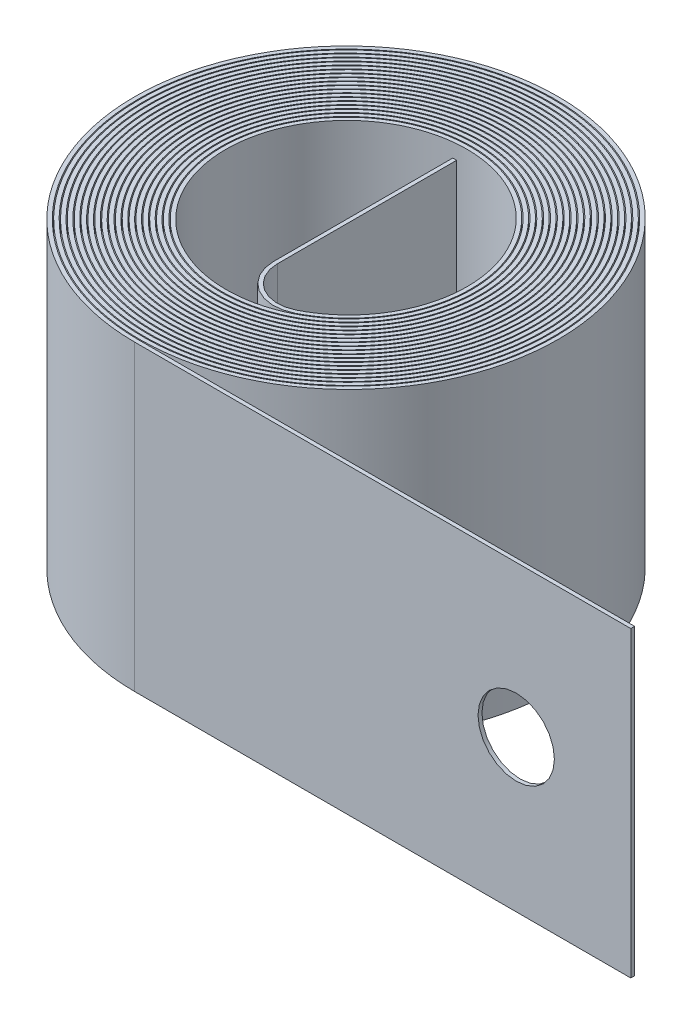
from build123d import *

# Parameters (mm, degrees)
EXTRUDE_THIN1_DEPTH = 7.9248
CUT_EXTRUDE2_REACH  = 20.849
SKETCH4_R           = 1


# Read off the part's stored shape, not the designer's step: Extrude-Thin1
with BuildPart() as part:
    # Extrude-Thin1 outline → Extrude-Thin1 (new body)
    with BuildSketch(Plane(origin=(0, 0, 0), x_dir=(1, 0, 0), z_dir=(0, 1, 0))):
        with BuildLine():
            Line((0.1016, -1.942264109), (0.1016, 2.75))
            Line((0.1016, 2.75), (0, 2.75))
            Line((0, 2.75), (0, -1.942264109))
            ThreePointArc((0, -1.942264109), (0.475427978, -2.793630184), (1.449648387, -2.835469756))
            add(Edge.make_bspline(
                [(0, -5.588), (-0.868617644, -5.584858073), (-1.73504116, -5.375606078), (-3.281339184, -4.590230038), (-3.96001627, -4.014736048), (-4.986347668, -2.620339653), (-5.333217056, -1.802536567), (-5.622523806, -0.098464806), (-5.564754712, 0.786471272), (-5.057851198, 2.435861002), (-4.609130852, 3.199033709), (-3.416788601, 4.442276836), (-2.674110908, 4.921390914), (-1.052864693, 5.494808097), (-0.175567394, 5.588682273), (1.527475673, 5.372300476), (2.35189537, 5.062232649), (3.773370618, 4.104875727), (4.369328184, 3.458349635), (5.207141535, 1.966653451), (5.448360757, 1.12265657), (5.525888712, -0.583526265), (5.362156452, -1.444380355), (4.665474672, -3.000562818), (4.13308643, -3.694685196), (2.813381258, -4.769610173), (2.027106139, -5.149589354), (0.367874111, -5.515742025), (-0.50378424, -5.501648928), (-2.147634466, -5.08340789), (-2.918548795, -4.67960512), (-4.196610968, -3.568842401), (-4.7027746, -2.862763673), (-5.343837892, -1.298679477), (-5.47825551, -0.441901538), (-5.347854416, 1.240483382), (-5.083156875, 2.064779454), (-4.211766629, 3.506383295), (-3.605770383, 4.122576567), (-2.181737737, 5.016897492), (-1.36482259, 5.294344008), (0.306338555, 5.452624756), (1.159279051, 5.333354931), (2.720431618, 4.724416775), (3.427432931, 4.235241645), (4.546138944, 2.991582651), (4.95698545, 2.238082004), (5.396296112, 0.627056872), (5.424436382, -0.229205729), (5.093075872, -1.862857532), (4.733852701, -2.638976209), (3.705167926, -3.946900128), (3.036524125, -4.477697125), (1.532269479, -5.182205338), (0.697840367, -5.355384635), (-0.959621844, -5.308410474), (-1.781362519, -5.088313158), (-3.238143591, -4.302522265), (-3.87205682, -3.737458847), (-4.818301267, -2.382981861), (-5.129910313, -1.594636085), (-5.365700678, 0.037759264), (-5.289717362, 0.880532624), (-4.767306799, 2.441859388), (-4.321305581, 3.159200996), (-3.15475764, 4.316862225), (-2.435134676, 4.756292604), (-0.875430553, 5.264931378), (-0.03657216, 5.33376153), (1.582384587, 5.08725937), (2.361222934, 4.772138637), (3.694088469, 3.825742942), (4.247087185, 3.195222164), (5.010743487, 1.753191425), (5.220822584, 0.942815514), (5.254513678, -0.685660443), (5.078118893, -1.502489717), (4.377284242, -2.969582907), (3.853408696, -3.618710756), (2.570094566, -4.612248003), (1.811669033, -4.955897768), (0.22155011, -5.265785125), (-0.608899104, -5.23180012), (-2.165736633, -4.794445117), (-2.89091574, -4.391435076), (-4.082709843, -3.30277507), (-4.548408279, -2.617988767), (-5.122419242, -1.112461059), (-5.230302211, -0.292901061), (-5.066407663, 1.307038466), (-4.794777403, 2.086171874), (-3.930599602, 3.439112177), (-3.338742642, 4.011874147), (-1.961054187, 4.830302672), (-1.176307385, 5.075347543), (0.41932975, 5.186747882), (1.228973971, 5.053035905), (2.701615399, 4.436246258), (3.363471336, 3.953667736), (4.399640808, 2.742838852), (4.773160848, 2.015545737), (5.153578198, 0.470972951), (5.160197685, -0.345097137), (4.806180326, -1.892927886), (4.445838664, -2.623485435), (3.43555851, -3.844610067), (2.786423165, -4.334236986), (1.337663866, -4.969554279), (0.539177921, -5.114766907), (-1.037608124, -5.031012943), (-1.814679208, -4.802131166), (-3.182896429, -4.019823585), (-3.772984903, -3.467024992), (-4.641747408, -2.155519382), (-4.919759978, -1.397846243), (-5.105733272, 0.16131959), (-5.013568285, 0.961593668), (-4.479652733, 2.435135126), (-4.038337013, 3.107259639), (-2.901032031, 4.1813876), (-2.205943373, 4.582567301), (-0.709938995, 5.029808658), (0.089804105, 5.075540108), (1.624269142, 4.802907417), (2.357797454, 4.484775161), (3.603486488, 3.553085758), (4.114687129, 2.940271043), (4.807151216, 1.550604984), (4.987891927, 0.774846421), (4.981608073, -0.774846421), (4.794607914, -1.547571861), (4.093553083, -2.926352414), (3.58006269, -3.531340779), (2.3363018, -4.445953272), (1.607013118, -4.754879624), (0.087722736, -5.012123763), (-0.701090506, -4.960260106), (-2.171013305, -4.507797289), (-2.85098191, -4.107569739), (-3.958397968, -3.044545608), (-4.38499503, -2.382592366), (-4.895231067, -0.937925627), (-4.978490395, -0.156345614), (-4.785065795, 1.360565413), (-4.508552105, 2.094715549), (-3.655388183, 3.360254953), (-3.07941968, 3.890667872), (-1.750901738, 4.636041892), (-0.999398225, 4.850438534), (0.519468069, 4.918764217), (1.285645099, 4.772659444), (2.670374429, 4.15197761), (3.287854474, 3.677902545), (4.243803782, 2.503169645), (4.581542436, 1.803440534), (4.906604324, 0.32719407), (4.893693026, -0.448167463), (4.521021086, -1.910095656), (4.161570067, -2.595526677), (3.17330498, -3.731580051), (2.545276578, -4.181328965), (1.15445901, -4.75062287), (0.392762215, -4.869741803), (-1.102588414, -4.753137187), (-1.835077235, -4.517524048), (-3.115820553, -3.742549888), (-3.663086035, -3.203810116), (-4.457072198, -1.938223375), (-4.703190009, -1.212374061), (-4.843088382, 0.272147706), (-4.736779228, 1.029660246), (-4.195336667, 2.415837061), (-3.760643812, 3.043427069), (-2.655944605, 4.036187273), (-1.986813073, 4.40059752), (-0.556536862, 4.789888219), (0.203486927, 4.814483803), (1.65319986, 4.51971101), (2.34176196, 4.2005917), (3.501837462, 3.287288962), (3.972457948, 2.693833333), (4.596781433, 1.35911505), (4.750015062, 0.618901883), (4.707643423, -0.851074367), (4.512090707, -1.579691273), (3.814706711, -2.871074674), (3.313436628, -3.43284302), (2.112291498, -4.27109899), (1.413364635, -4.54694868), (-0.033518132, -4.755220852), (-0.780342533, -4.687500166), (-2.163592459, -4.223918245), (-2.798945098, -3.828437147), (-3.823993791, -2.794501742), (-4.212904049, -2.156867748), (-4.662714182, -0.775240462), (-4.723281704, -0.032331028), (-4.504297737, 1.401113137), (-4.22493636, 2.090532571), (-3.386529142, 3.27006625), (-2.828153247, 3.759271631), (-1.551520179, 4.434521036), (-0.834268037, 4.620055533), (0.606721958, 4.649144104), (1.329335289, 4.492694988), (2.626892116, 3.872045065), (3.200831793, 3.40834603), (4.078987002, 2.272880318), (4.382532906, 1.602011361), (4.655832547, 0.195831308), (4.625392227, -0.538379093), (4.238057186, -1.914467702), (3.881483405, -2.555277694), (2.918769208, -3.608112011), (2.313394211, -4.019328171), (0.982842254, -4.525843539), (0.258710212, -4.620765838), (-1.154589938, -4.475253664), (-1.842657512, -4.234952109), (-3.037151911, -3.47110907), (-3.542657406, -2.948179901), (-4.264669845, -1.731351967), (-4.480630314, -1.038412416), (-4.578234175, 0.370190427), (-4.459820884, 1.084753504), (-3.914800624, 2.384128305), (-3.488636819, 2.967933916), (-2.419816734, 3.881605755), (-1.778006927, 4.210774043), (-0.415356174, 4.545622296), (0.304417096, 4.551059984), (1.669262281, 4.238133408), (2.313273822, 3.920032274), (3.389426183, 3.028727788), (3.820739924, 2.456234776), (4.380057271, 1.17892861), (4.507642412, 0.475119724), (4.43309072, -0.914349778), (4.231031523, -1.598927494), (3.541163274, -2.803966474), (3.053909326, -3.32349736), (1.898339562, -4.088066864), (1.230935984, -4.332525298), (-0.14209781, -4.495541394), (-0.846654603, -4.413991255), (-2.143616583, -3.943256849), (-2.735016646, -3.554458145), (-3.679826487, -2.552980232), (-4.032513393, -1.941095676), (-4.425314051, -0.624558229), (-4.465140065, 0.079062035), (-4.224569985, 1.428745693), (-3.944380765, 2.073759601), (-3.124410267, 3.16881313), (-2.585284273, 3.618010173), (-1.363135685, 4.226153052), (-0.681075198, 4.384641927), (0.681075198, 4.378358073), (1.360102561, 4.21360975), (2.571365644, 3.596876127), (3.102665288, 3.145389332), (3.905558877, 2.052263947), (4.176542191, 1.411489669), (4.40172372, 0.076980666), (4.355765499, -0.61570974), (3.957743381, -1.906165608), (3.606008627, -2.502930111), (2.672302616, -3.474519099), (2.091073823, -3.848599147), (0.822986561, -4.295654036), (0.137123835, -4.368298517), (-1.193655154, -4.197831114), (-1.837535729, -3.954871562), (-2.947139287, -3.20590064), (-3.412007561, -2.700489724), (-4.064942248, -1.535150025), (-4.25251631, -0.876139879), (-4.311639723, 0.455409872), (-4.183162435, 1.126909844), (-3.638480549, 2.34018604), (-3.222718661, 2.881023752), (-2.192958032, 3.717997392), (-1.579774929, 4.013495517), (-0.286514029, 4.297466623), (0.392550687, 4.285737124), (1.672556845, 3.958634281), (2.272504559, 3.643535014), (3.266549134, 2.77776756), (3.659883331, 2.227789484), (4.157407849, 1.010238543), (4.261228096, 0.343622893), (4.158419958, -0.964693445), (3.951891221, -1.605375015), (3.273333147, -2.725257812), (2.80184985, -3.203595503), (1.694709013, -3.897246903), (1.059925533, -4.11203601), (-0.237956857, -4.233552009), (-0.900041441, -4.140203524), (-2.111242505, -3.666256559), (-2.659421207, -3.286045979), (-3.526235603, -2.320306559), (-3.84420959, -1.735544142), (-4.183480326, -0.486016851), (-4.204531225, 0.177768126), (-3.946346147, 1.443542188), (-3.667330698, 2.044547712), (-2.869409998, 3.056774797), (-2.351142541, 3.467218771), (-1.185960622, 4.011357528), (-0.539963398, 4.144645488), (0.74252689, 4.106876371), (1.378020027, 3.935868256), (2.504005757, 3.326891157), (2.993629219, 2.889414408), (3.723896713, 1.841601134), (3.963987046, 1.232093186), (4.144741027, -0.029276999), (4.085282971, -0.680152442), (3.68052969, -1.88532553), (3.335568714, -2.4386892), (2.434245844, -3.331125358), (1.878600819, -3.669515495), (0.675050371, -4.060496987), (0.028089896, -4.112801878), (-1.219841687, -3.921336103), (-1.819842207, -3.677734084), (-2.846044031, -2.947315342), (-3.271456077, -2.461084331), (-3.858298584, -1.349848933), (-4.019288481, -0.72572056), (-4.043774531, 0.527783473), (-3.907271083, 1.15618086), (-3.366805888, 2.284201324), (-2.963283364, 2.782952829), (-1.975666069, 3.545726), (-1.39235369, 3.809168043), (-0.170112506, 4.045879968), (0.467859082, 4.018984334), (1.663198771, 3.681669256), (2.219639648, 3.371531734), (3.133514178, 2.534763346), (3.490248062, 2.008799654), (3.929267835, 0.853223449), (4.011229464, 0.224519363), (3.884099664, -1.002141409), (3.675126814, -1.59914315), (3.011618538, -2.635191645), (2.55761716, -3.073440665), (1.501649747, -3.699037018), (0.900517447, -3.885913085), (-0.321051104, -3.969720468), (-0.940533037, -3.866605862), (-2.06664121, -3.393354989), (-2.572396495, -3.023605902), (-3.363570702, -2.096794616), (-3.648387238, -1.540468116), (-3.937666394, -0.359739398), (-3.941922283, 0.263737055), (-3.670086489, 1.445596676), (-3.394225884, 2.003062209), (-2.621897066, 2.934242299), (-2.126046386, 3.307242863), (-1.020193355, 3.790560262), (-0.411061527, 3.900517917), (0.791091432, 3.835168497), (1.383175781, 3.659931879), (2.425036518, 3.062502963), (2.874009816, 2.640793661), (3.53438632, 1.641159741), (3.745290617, 1.064025724), (3.885349516, -0.12287603), (3.814414224, -0.731715537), (3.406860966, -1.852098041), (3.070579277, -2.362773654), (2.204928433, -3.178265374), (1.676247979, -3.482459485), (0.539177463, -3.820819444), (-0.068319965, -3.854740022), (-1.233222244, -3.646232552), (-1.789721748, -3.40398637), (-2.734139772, -2.695734776), (-3.121333218, -2.230297503), (-3.645154888, -1.175666385), (-3.781391927, -0.587303975), (-3.775108073, 0.587303975), (-3.632611586, 1.172633262), (-3.100199172, 2.216378875), (-2.710715975, 2.673989797), (-1.768226094, 3.365164481), (-1.21596622, 3.598204759), (-0.066238596, 3.791323677), (0.530328974, 3.751270892), (1.641317911, 3.407689473), (2.154878312, 3.104447514), (2.990640231, 2.300059623), (3.312203263, 1.799555281), (3.696077005, 0.708047496), (3.758106639, 0.117902055), (3.610596434, -1.026744894), (3.401191018, -1.580355908), (2.756413097, -2.534023622), (2.321559768, -2.93334725), (1.319398311, -3.493842604), (0.752881533, -3.654594087), (-0.391351675, -3.704515228), (-0.968174588, -3.593665426), (-2.00999765, -3.124983487), (-2.47419303, -2.767534777), (-3.192191002, -1.882746419), (-3.445448598, -1.356109324), (-3.688328922, -0.245833988), (-3.677781222, 0.33693391), (-3.396247476, 1.435018035), (-3.125499961, 1.949482441), (-2.382230139, 2.801518217), (-1.91030239, 3.138437696), (-0.866018076, 3.564192827), (-0.29448357, 3.652714389), (0.826798476, 3.563702729), (1.375672795, 3.386258394), (2.334695071, 2.804116406), (2.744104971, 2.399889584), (3.337421609, 1.45119465), (3.52088201, 0.907477004), (3.624015635, -0.203766008), (3.54362782, -0.770422636), (3.137176451, -1.806647948), (2.811448147, -2.275415345), (1.984668512, -3.016283932), (1.48427521, -3.28782166), (0.415496841, -3.577072433), (-0.152049324, -3.594578646), (-1.233884516, -3.372981285), (-1.747333463, -3.134069697), (-2.611712131, -2.451531034), (-2.961979594, -2.00845175), (-3.425933623, -1.012806193), (-3.539275915, -0.461024913), (-3.50610932, 0.633979413), (-3.359645804, 1.176348781), (-2.839075602, 2.13693684), (-2.465392189, 2.554415419), (-1.57091077, 3.176694436), (-1.050821736, 3.381025413), (0.025035867, 3.534261201), (0.57996235, 3.483065776), (1.607058602, 3.137141136), (2.078433302, 2.842700281), (2.838256925, 2.073989946), (3.12612694, 1.600333891), (3.458279792, 0.57486028), (3.502322053, 0.023848763), (3.33837447, -1.038570237), (3.130531807, -1.549151843), (2.508101542, -2.422021811), (2.094015414, -2.783640523), (1.148177687, -3.282076133), (0.617173083, -3.41852143), (-0.448844989, -3.438404957), (-0.983026431, -3.321847177), (-1.941510533, -2.861566711), (-2.365073865, -2.518220699), (-3.012464999, -1.678451821), (-3.235803181, -1.182696018), (-3.43592739, -0.144393705), (-3.412576441, 0.397339072), (-3.125281326, 1.411929839), (-2.861580063, 1.884001601), (-2.150757484, 2.658916345), (-1.704205098, 2.961167954), (-0.723604644, 3.332692132), (-0.190328514, 3.401693091), (0.84969288, 3.292945665), (1.355628788, 3.11530152), (2.233231379, 2.552128005), (2.604223924, 2.167054419), (3.133404191, 1.271947527), (3.291195856, 0.762622479), (3.361206761, -0.271911781), (3.273390841, -0.79631257), (2.871909355, -1.749154116), (2.558574985, -2.176859075), (1.773772498, -2.845535649), (1.302929306, -3.086000433), (0.304122621, -3.329710492), (-0.223057013, -3.332784581), (-1.221931071, -3.10203957), (-1.692850596, -2.868419494), (-2.479058415, -2.215066344), (-2.793745801, -1.795857997), (-3.201063253, -0.861458099), (-3.293393423, -0.347003331), (-3.237246274, 0.667833086), (-3.088832235, 1.167424068), (-2.583842652, 2.046106563), (-2.227677995, 2.424522273), (-1.38397992, 2.980705776), (-0.897115465, 3.158055936), (0.10365425, 3.275157638), (0.616776472, 3.214837193), (1.560579498, 2.870465082), (1.990530661, 2.586700408), (2.676704262, 1.856876634), (2.932405576, 1.411400282), (3.216324838, 0.453796697), (3.244339979, -0.057577895), (3.06789512, -1.037698795), (2.863591974, -1.505683895), (2.271076629, -2.294120693), (1.885846682, -2.615883303), (1.449648387, -2.835469756)],
                knots=[0, 0, 0, 0, 0.00390625, 0.00390625, 0.0078125, 0.0078125, 0.01171875, 0.01171875, 0.015625, 0.015625, 0.01953125, 0.01953125, 0.0234375, 0.0234375, 0.02734375, 0.02734375, 0.03125, 0.03125, 0.03515625, 0.03515625, 0.0390625, 0.0390625, 0.04296875, 0.04296875, 0.046875, 0.046875, 0.05078125, 0.05078125, 0.0546875, 0.0546875, 0.05859375, 0.05859375, 0.0625, 0.0625, 0.06640625, 0.06640625, 0.0703125, 0.0703125, 0.07421875, 0.07421875, 0.078125, 0.078125, 0.08203125, 0.08203125, 0.0859375, 0.0859375, 0.08984375, 0.08984375, 0.09375, 0.09375, 0.09765625, 0.09765625, 0.1015625, 0.1015625, 0.10546875, 0.10546875, 0.109375, 0.109375, 0.11328125, 0.11328125, 0.1171875, 0.1171875, 0.12109375, 0.12109375, 0.125, 0.125, 0.12890625, 0.12890625, 0.1328125, 0.1328125, 0.13671875, 0.13671875, 0.140625, 0.140625, 0.14453125, 0.14453125, 0.1484375, 0.1484375, 0.15234375, 0.15234375, 0.15625, 0.15625, 0.16015625, 0.16015625, 0.1640625, 0.1640625, 0.16796875, 0.16796875, 0.171875, 0.171875, 0.17578125, 0.17578125, 0.1796875, 0.1796875, 0.18359375, 0.18359375, 0.1875, 0.1875, 0.19140625, 0.19140625, 0.1953125, 0.1953125, 0.19921875, 0.19921875, 0.203125, 0.203125, 0.20703125, 0.20703125, 0.2109375, 0.2109375, 0.21484375, 0.21484375, 0.21875, 0.21875, 0.22265625, 0.22265625, 0.2265625, 0.2265625, 0.23046875, 0.23046875, 0.234375, 0.234375, 0.23828125, 0.23828125, 0.2421875, 0.2421875, 0.24609375, 0.24609375, 0.25, 0.25, 0.25390625, 0.25390625, 0.2578125, 0.2578125, 0.26171875, 0.26171875, 0.265625, 0.265625, 0.26953125, 0.26953125, 0.2734375, 0.2734375, 0.27734375, 0.27734375, 0.28125, 0.28125, 0.28515625, 0.28515625, 0.2890625, 0.2890625, 0.29296875, 0.29296875, 0.296875, 0.296875, 0.30078125, 0.30078125, 0.3046875, 0.3046875, 0.30859375, 0.30859375, 0.3125, 0.3125, 0.31640625, 0.31640625, 0.3203125, 0.3203125, 0.32421875, 0.32421875, 0.328125, 0.328125, 0.33203125, 0.33203125, 0.3359375, 0.3359375, 0.33984375, 0.33984375, 0.34375, 0.34375, 0.34765625, 0.34765625, 0.3515625, 0.3515625, 0.35546875, 0.35546875, 0.359375, 0.359375, 0.36328125, 0.36328125, 0.3671875, 0.3671875, 0.37109375, 0.37109375, 0.375, 0.375, 0.37890625, 0.37890625, 0.3828125, 0.3828125, 0.38671875, 0.38671875, 0.390625, 0.390625, 0.39453125, 0.39453125, 0.3984375, 0.3984375, 0.40234375, 0.40234375, 0.40625, 0.40625, 0.41015625, 0.41015625, 0.4140625, 0.4140625, 0.41796875, 0.41796875, 0.421875, 0.421875, 0.42578125, 0.42578125, 0.4296875, 0.4296875, 0.43359375, 0.43359375, 0.4375, 0.4375, 0.44140625, 0.44140625, 0.4453125, 0.4453125, 0.44921875, 0.44921875, 0.453125, 0.453125, 0.45703125, 0.45703125, 0.4609375, 0.4609375, 0.46484375, 0.46484375, 0.46875, 0.46875, 0.47265625, 0.47265625, 0.4765625, 0.4765625, 0.48046875, 0.48046875, 0.484375, 0.484375, 0.48828125, 0.48828125, 0.4921875, 0.4921875, 0.49609375, 0.49609375, 0.5, 0.5, 0.50390625, 0.50390625, 0.5078125, 0.5078125, 0.51171875, 0.51171875, 0.515625, 0.515625, 0.51953125, 0.51953125, 0.5234375, 0.5234375, 0.52734375, 0.52734375, 0.53125, 0.53125, 0.53515625, 0.53515625, 0.5390625, 0.5390625, 0.54296875, 0.54296875, 0.546875, 0.546875, 0.55078125, 0.55078125, 0.5546875, 0.5546875, 0.55859375, 0.55859375, 0.5625, 0.5625, 0.56640625, 0.56640625, 0.5703125, 0.5703125, 0.57421875, 0.57421875, 0.578125, 0.578125, 0.58203125, 0.58203125, 0.5859375, 0.5859375, 0.58984375, 0.58984375, 0.59375, 0.59375, 0.59765625, 0.59765625, 0.6015625, 0.6015625, 0.60546875, 0.60546875, 0.609375, 0.609375, 0.61328125, 0.61328125, 0.6171875, 0.6171875, 0.62109375, 0.62109375, 0.625, 0.625, 0.62890625, 0.62890625, 0.6328125, 0.6328125, 0.63671875, 0.63671875, 0.640625, 0.640625, 0.64453125, 0.64453125, 0.6484375, 0.6484375, 0.65234375, 0.65234375, 0.65625, 0.65625, 0.66015625, 0.66015625, 0.6640625, 0.6640625, 0.66796875, 0.66796875, 0.671875, 0.671875, 0.67578125, 0.67578125, 0.6796875, 0.6796875, 0.68359375, 0.68359375, 0.6875, 0.6875, 0.69140625, 0.69140625, 0.6953125, 0.6953125, 0.69921875, 0.69921875, 0.703125, 0.703125, 0.70703125, 0.70703125, 0.7109375, 0.7109375, 0.71484375, 0.71484375, 0.71875, 0.71875, 0.72265625, 0.72265625, 0.7265625, 0.7265625, 0.73046875, 0.73046875, 0.734375, 0.734375, 0.73828125, 0.73828125, 0.7421875, 0.7421875, 0.74609375, 0.74609375, 0.75, 0.75, 0.75390625, 0.75390625, 0.7578125, 0.7578125, 0.76171875, 0.76171875, 0.765625, 0.765625, 0.76953125, 0.76953125, 0.7734375, 0.7734375, 0.77734375, 0.77734375, 0.78125, 0.78125, 0.78515625, 0.78515625, 0.7890625, 0.7890625, 0.79296875, 0.79296875, 0.796875, 0.796875, 0.80078125, 0.80078125, 0.8046875, 0.8046875, 0.80859375, 0.80859375, 0.8125, 0.8125, 0.81640625, 0.81640625, 0.8203125, 0.8203125, 0.82421875, 0.82421875, 0.828125, 0.828125, 0.83203125, 0.83203125, 0.8359375, 0.8359375, 0.83984375, 0.83984375, 0.84375, 0.84375, 0.84765625, 0.84765625, 0.8515625, 0.8515625, 0.85546875, 0.85546875, 0.859375, 0.859375, 0.86328125, 0.86328125, 0.8671875, 0.8671875, 0.87109375, 0.87109375, 0.875, 0.875, 0.87890625, 0.87890625, 0.8828125, 0.8828125, 0.88671875, 0.88671875, 0.890625, 0.890625, 0.89453125, 0.89453125, 0.8984375, 0.8984375, 0.90234375, 0.90234375, 0.90625, 0.90625, 0.91015625, 0.91015625, 0.9140625, 0.9140625, 0.91796875, 0.91796875, 0.921875, 0.921875, 0.92578125, 0.92578125, 0.9296875, 0.9296875, 0.93359375, 0.93359375, 0.9375, 0.9375, 0.94140625, 0.94140625, 0.9453125, 0.9453125, 0.94921875, 0.94921875, 0.953125, 0.953125, 0.95703125, 0.95703125, 0.9609375, 0.9609375, 0.96484375, 0.96484375, 0.96875, 0.96875, 0.97265625, 0.97265625, 0.9765625, 0.9765625, 0.98046875, 0.98046875, 0.984375, 0.984375, 0.98828125, 0.98828125, 0.9921875, 0.9921875, 0.996041137, 0.996041137, 0.996041137, 0.996041137], degree=3))
            Line((0, -5.588), (13, -5.588))
            Line((13, -5.588), (13, -5.4864))
            Line((13, -5.4864), (2e-09, -5.486399323))
            add(Edge.make_bspline(
                [(2e-09, -5.486399323), (-0.849169243, -5.483269837), (-1.696977537, -5.279253566), (-3.21000401, -4.514219607), (-3.875417306, -3.952950384), (-4.883742412, -2.593550288), (-5.22658569, -1.795017946), (-5.518662559, -0.130818667), (-5.46750161, 0.735194668), (-4.984008028, 2.351146392), (-4.551026537, 3.101165339), (-3.396892125, 4.327238546), (-2.675024271, 4.802966204), (-1.09667215, 5.381170212), (-0.239657535, 5.482897038), (1.427606303, 5.293165897), (2.23796534, 5.000664904), (3.641183579, 4.085780076), (4.233588879, 3.462310276), (5.0768733, 2.018290251), (5.32674052, 1.196920117), (5.433663137, -0.468971369), (5.289320045, -1.313764462), (4.639819346, -2.848397257), (4.133184124, -3.537790272), (2.867267238, -4.617022919), (2.10680171, -5.005699863), (0.494374088, -5.402843542), (-0.358134656, -5.409625106), (-1.974812637, -5.043055806), (-2.738672165, -4.667850118), (-4.017634159, -3.617769508), (-4.531545369, -2.941305546), (-5.203453048, -1.432212128), (-5.359569952, -0.598673112), (-5.284431702, 1.048629038), (-5.050990448, 1.862336945), (-4.247320971, 3.298933681), (-3.675090522, 3.920727338), (-2.315439167, 4.843497664), (-1.526686316, 5.142508907), (0.099402342, 5.358082544), (0.93703641, 5.272200054), (2.484680374, 4.737474657), (3.193810639, 4.286239823), (4.335937248, 3.116969117), (4.766999578, 2.397149698), (5.26346742, 0.84289804), (5.326262388, 0.007738292), (5.074350538, -1.601381833), (4.756913834, -2.374785621), (3.812563651, -3.698226492), (3.183416065, -4.246479594), (1.74883544, -5.005330364), (0.942196289, -5.213259009), (-0.677432422, -5.249023972), (-1.490278371, -5.073867949), (-2.951719158, -4.381564179), (-3.598793109, -3.86176147), (-4.593495709, -2.590425582), (-4.93851128, -1.837186263), (-5.257754063, -0.257799079), (-5.228820335, 0.568686254), (-4.807503445, 2.12095576), (-4.412099854, 2.845583545), (-3.342000854, 4.042505617), (-2.665105745, 4.512357742), (-1.174902932, 5.102046393), (-0.360733239, 5.218659619), (1.232858398, 5.078578721), (2.011573121, 4.818575658), (3.371112867, 3.980992546), (3.949775879, 3.400752093), (4.788549887, 2.045353348), (5.045487614, 1.268791111), (5.187973112, -0.315859084), (5.070016997, -1.123753073), (4.488607207, -2.601646409), (4.022088914, -3.269861854), (2.842395758, -4.32879279), (2.127283485, -4.716497474), (0.601010213, -5.134016433), (-0.210511026, -5.160236567), (-1.759271038, -4.850376926), (-2.495186096, -4.510904642), (-3.738767794, -3.54186884), (-4.243692839, -2.909867446), (-4.920182273, -1.489036713), (-5.088172394, -0.699276291), (-5.056567484, 0.871165677), (-4.853343659, 1.651046387), (-4.122936067, 3.038381001), (-3.592868912, 3.64345852), (-2.320726056, 4.554923087), (-1.577155992, 4.857865692), (-0.034352951, 5.102433036), (0.764643088, 5.040294537), (2.250783545, 4.568704659), (2.935997846, 4.155997776), (4.05135024, 3.070653444), (4.478278254, 2.3959888), (4.988310902, 0.928733022), (5.067624695, 0.135796642), (4.866713603, -1.401608253), (4.582948734, -2.144655844), (3.716240376, -3.426770762), (3.130787805, -3.962956871), (1.784087897, -4.71955521), (1.021917457, -4.936255706), (-0.518136419, -5.009276758), (-1.29515083, -4.861870093), (-2.702096988, -4.238433237), (-3.329556984, -3.75948029), (-4.306313223, -2.57406564), (-4.652078598, -1.866128667), (-4.993671785, -0.371578229), (-4.985687177, 0.414739653), (-4.622263414, 1.901149081), (-4.263569428, 2.59924216), (-3.274660616, 3.76315311), (-2.642463205, 4.225713555), (-1.239600259, 4.822170605), (-0.468656354, 4.952271707), (1.049873634, 4.857272523), (1.795979657, 4.628676064), (3.108556544, 3.864942223), (3.672123294, 3.327375975), (4.501912171, 2.058989696), (4.76445349, 1.327336701), (4.937790827, -0.175503919), (4.84494477, -0.945755466), (4.32767863, -2.364293616), (3.90045705, -3.010093929), (2.804638052, -4.044623286), (2.134690274, -4.429875783), (0.694311043, -4.863061654), (-0.075734492, -4.907302879), (-1.554701104, -4.649837012), (-2.261601157, -4.345038151), (-3.466197979, -3.454037302), (-3.960700612, -2.866019857), (-4.637209592, -1.532380763), (-4.815565916, -0.78660703), (-4.822945836, 0.705887957), (-4.648674426, 1.451083045), (-3.98795826, 2.786150275), (-3.499297083, 3.373175012), (-2.312823269, 4.269055222), (-1.61434916, 4.574387817), (-0.155106112, 4.843309314), (0.604643422, 4.803487724), (2.026959065, 4.391017951), (2.68707344, 4.015824776), (3.771783926, 3.011864224), (4.193059246, 2.381968548), (4.712068895, 1.001171821), (4.806362068, 0.250788205), (4.652119305, -1.213326967), (4.400786781, -1.925035346), (3.60856051, -3.162480902), (3.066125159, -3.685162063), (1.805983881, -4.43511158), (1.088313191, -4.658986804), (-0.371377564, -4.764750723), (-1.111820005, -4.643669212), (-2.461548558, -4.085426281), (-3.068092496, -3.646371183), (-4.022829701, -2.544820061), (-4.367747803, -1.881909509), (-4.727137648, -0.472182926), (-4.738541251, 0.273503076), (-4.428942816, 1.692026051), (-4.105760645, 2.362469553), (-3.195320254, 3.48974142), (-2.607240132, 3.943471863), (-1.290912663, 4.542243044), (-0.563359062, 4.68418823), (0.878833562, 4.629937395), (1.591448678, 4.431341557), (2.853985566, 3.738162272), (3.401034068, 3.242398945), (4.217618491, 2.059463018), (4.484094492, 1.372570442), (4.683820732, -0.047966068), (4.614516447, -0.779963416), (4.157633964, -2.136708187), (3.768571314, -2.758842087), (2.754363242, -3.76511233), (2.129115462, -4.146278289), (0.774337339, -4.590677088), (0.046080129, -4.651261356), (-1.361361472, -4.442084783), (-2.038215114, -4.17058945), (-3.200445745, -3.354736701), (-3.682985649, -2.809931996), (-4.355205952, -1.562422051), (-4.542198058, -0.86063003), (-4.584243931, 0.552938219), (-4.437366226, 1.262678313), (-3.842926822, 2.54267171), (-3.394613781, 3.110254531), (-2.29201829, 3.986518837), (-1.638310103, 4.292518895), (-0.26283321, 4.581396592), (0.457196047, 4.562195164), (1.813535276, 4.20501404), (2.447364552, 3.866020711), (3.497799343, 2.940988243), (3.911768363, 2.355210394), (4.435414351, 1.060307519), (4.542908668, 0.352631162), (4.431208675, -1.036756597), (4.210778812, -1.716191035), (3.489996996, -2.905838827), (2.989621961, -3.413490019), (1.814728674, -4.152640565), (1.141380108, -4.381891191), (0.10739983, -4.482554396), (-0.240856039, -4.476321981), (-0.925984122, -4.382592029), (-1.262979658, -4.295513305), (-1.907969128, -4.047229065), (-2.215893051, -3.885989972), (-2.785248695, -3.496109151), (-3.046972614, -3.267769612), (-3.511414894, -2.757922065), (-3.714062188, -2.476417999), (-4.047745917, -1.87407298), (-4.179165608, -1.553358258), (-4.365599569, -0.890868782), (-4.420558756, -0.549128658), (-4.44901068, 0.137421142), (-4.422884065, 0.482295375), (-4.293053819, 1.156681699), (-4.18932174, 1.486141741), (-3.907817808, 2.111374342), (-3.73033749, 2.407371634), (-3.313034102, 2.950987005), (-3.073211727, 3.19855115), (-2.542587928, 3.630526991), (-2.25192979, 3.815257572), (-1.636619224, 4.113693132), (-1.311991525, 4.227355888), (-0.645501316, 4.375559681), (-0.303614629, 4.410430459), (0.37874036, 4.401613636), (0.719170226, 4.357904021), (1.380027024, 4.192208441), (1.700622763, 4.07048398), (2.30543627, 3.757584657), (2.589614015, 3.566409975), (3.105132364, 3.123188716), (3.33672997, 2.871279856), (3.736429684, 2.32176288), (3.904500686, 2.024173096), (4.166303657, 1.398325406), (4.26030728, 1.070061861), (4.371242602, 0.4011451), (4.388158492, 0.06052031), (4.34197955, -0.614846155), (4.27910043, -0.949717806), (4.079046487, -1.596066255), (3.941872389, -1.907513803), (3.598797861, -2.489392494), (3.393007888, -2.760027902), (2.925603277, -3.247220426), (2.664002529, -3.463755241), (2.09784642, -3.829521764), (1.793280108, -3.97896637), (1.158515583, -4.204659655), (0.828338193, -4.280897395), (0.159764171, -4.354150217), (-0.178745351, -4.351324578), (-0.845915798, -4.268917033), (-1.174555774, -4.189335989), (-1.803750427, -3.955851599), (-2.104472249, -3.802012461), (-2.66282301, -3.430259996), (-2.920436199, -3.212356475), (-3.377394189, -2.722827817), (-3.576899577, -2.451162267), (-3.908827889, -1.869929754), (-4.041242845, -1.560376935), (-4.230099753, -0.919413296), (-4.286640319, -0.587881585), (-4.322935519, 0.079011645), (-4.302689662, 0.414359204), (-4.184682853, 1.070585148), (-4.086925324, 1.391615022), (-3.821196239, 2.002771608), (-3.653228979, 2.292887959), (-3.254645566, 2.825568964), (-3.023935623, 3.068257378), (-2.513689415, 3.494681627), (-2.234161274, 3.678410523), (-1.640490344, 3.975469733), (-1.326198502, 4.088839021), (-0.680400749, 4.241163425), (-0.348907336, 4.280115165), (0.31348617, 4.279775371), (0.644532331, 4.240422156), (1.288726447, 4.087634234), (1.601859498, 3.974202823), (2.19263171, 3.677835225), (2.470356766, 3.494754976), (2.976731545, 3.070500739), (3.205368014, 2.829338409), (3.599931248, 2.300897253), (3.765845327, 2.013438519), (4.027927472, 1.408623663), (4.124088967, 1.091286583), (4.239885511, 0.443513202), (4.25940172, 0.112921881), (4.204569209, -0.872107571), (4.013268152, -1.518362094), (3.360978926, -2.657295078), (2.901477998, -3.148307614), (1.810502745, -3.872735651), (1.181132807, -4.105385693), (-0.115889524, -4.263960471), (-0.78131866, -4.190207489), (-2.009209373, -3.751911138), (-2.569857595, -3.388707872), (-3.469280741, -2.448877986), (-3.807086669, -1.874297684), (-4.189321446, -0.633903305), (-4.233862772, 0.02963907), (-4.020397863, 1.306968441), (-3.763568352, 1.918795849), (-3.002211984, 2.962800899), (-2.499657087, 3.393798834), (-1.353860671, 3.984772305), (-0.712927279, 4.144635398), (0.573299363, 4.159656544), (1.216490744, 4.015807502), (2.370542829, 3.454300175), (2.880006791, 3.038518084), (3.658460967, 2.021820283), (3.927097358, 1.423231916), (4.167055779, 0.168385127), (4.139162999, -0.485637422), (3.792335536, -1.712219242), (3.475154793, -2.283161023), (2.617549733, -3.222253204), (2.07944888, -3.589792226), (0.894733523, -4.044143374), (0.25047497, -4.131506821), (-1.009354945, -4.007267189), (-1.623088677, -3.797264747), (-2.691309325, -3.123358528), (-3.144913215, -2.661745099), (-3.796541957, -1.583190714), (-3.994857388, -0.968705217), (-4.094035587, 0.284584253), (-3.99631109, 0.921336954), (-3.524621714, 2.083562309), (-3.152878956, 2.607870135), (-2.212698262, 3.433717185), (-1.646787532, 3.735260481), (-0.439077374, 4.051678438), (0.200470811, 4.067741212), (1.419115216, 3.810199671), (1.996760381, 3.538709021), (2.968627551, 2.764338083), (3.362544415, 2.264021725), (3.883305696, 1.138964045), (4.011076524, 0.516652194), (3.97274212, -0.719578028), (3.808597988, -1.331762004), (3.221899851, -2.417268441), (2.801904666, -2.889958897), (1.793469322, -3.595946137), (1.2076066, -3.829872214), (-0.007365749, -4.008868248), (-0.634469121, -3.9557004), (-1.798126304, -3.572355149), (-2.333710524, -3.244683783), (-3.200272081, -2.382713019), (-3.531549977, -1.851100332), (-3.919218855, -0.695019468), (-3.977126559, -0.072808494), (-3.806224578, 1.131561433), (-3.579816085, 1.712411051), (-2.889144374, 2.710212624), (-2.427630628, 3.127110709), (-1.365699194, 3.708380616), (-0.76775895, 3.873979095), (0.439139879, 3.917827608), (1.046457084, 3.798319405), (2.142469132, 3.298063287), (2.630737896, 2.920074422), (3.384686546, 1.984100133), (3.651262721, 1.428772087), (3.905408821, 0.257063602), (3.895006178, -0.357361788), (3.598044215, -1.515949689), (3.314195323, -2.059305749), (2.531584852, -2.95990069), (2.035611434, -3.317671758), (0.935169078, -3.771138227), (0.332939502, -3.868593907), (-0.851141551, -3.781250585), (-1.431808985, -3.599052236), (-2.448798619, -2.992012509), (-2.885263842, -2.570033391), (-3.520987346, -1.574179035), (-3.721690508, -1.002787412), (-3.84363125, 0.169442359), (-3.76729799, 0.768733419), (-3.352212729, 1.868658464), (-3.016334687, 2.369031711), (-2.154628405, 3.164486711), (-1.631478148, 3.460656701), (-0.507528081, 3.784994366), (0.09138818, 3.815360016), (1.23867989, 3.602358802), (1.786388085, 3.361811728), (2.714374112, 2.659176937), (3.095351521, 2.19990331), (3.608958048, 1.158613337), (3.743498951, 0.578778734), (3.736229732, -0.579350455), (3.597118461, -1.156581195), (3.073125888, -2.186146283), (2.691130106, -2.638770649), (1.763781474, -3.322781086), (1.220859571, -3.555745014), (0.088219792, -3.751354372), (-0.5000605, -3.716512814), (-1.59752962, -3.384843683), (-2.106590553, -3.090904386), (-2.937080786, -2.3047411), (-3.259715889, -1.815139123), (-3.649034729, -0.742973878), (-3.717985422, -0.162186556), (-3.586088306, 0.967887883), (-3.388061585, 1.516634252), (-2.765493407, 2.465448488), (-2.343699839, 2.86632357), (-1.364572044, 3.434249402), (-0.809305266, 3.603268237), (0.317586597, 3.672217639), (0.888276791, 3.574833824), (1.923976433, 3.132803561), (2.389381064, 2.790961203), (3.115441931, 1.934023488), (3.377724443, 1.421230418), (3.642282668, 0.33266502), (3.647044883, -0.241810186), (3.396577621, -1.330712299), (3.144137164, -1.845122888), (2.434266119, -2.70420244), (1.979308423, -3.050124878), (0.96247337, -3.499002272), (0.402211376, -3.604188455), (-0.705059776, -3.550134359), (-1.251655849, -3.39359824), (-2.214854233, -2.850676619), (-2.632319715, -2.466865505), (-3.248622111, -1.552400032), (-3.449388885, -1.023624976), (-3.59036486, 0.067145036), (-3.533128168, 0.628358591), (-3.171495609, 1.663959871), (-2.869704683, 2.138817365), (-2.084561514, 2.900663794), (-1.603290267, 3.189247348), (-0.562830252, 3.517776466), (-0.004750233, 3.560068469), (1.069763631, 3.388155637), (1.586285366, 3.176516746), (2.467573908, 2.543170698), (2.833580041, 2.123678878), (3.336421363, 1.165228583), (3.475347972, 0.627654606), (3.495502982, -0.451589019), (3.379193427, -0.992990278), (2.91500362, -1.964285566), (2.569403762, -2.395058322), (1.721588693, -3.053713797), (1.220973972, -3.283398062), (0.170788816, -3.491907785), (-0.37819535, -3.473034238), (-1.407707731, -3.189777806), (-1.888763706, -2.927672546), (-2.680143389, -2.215190985), (-2.991958046, -1.766566246), (-3.379260675, -0.777775406), (-3.45684198, -0.238464256), (-3.36043148, 0.816159657), (-3.18865155, 1.331673174), (-2.631558985, 2.228895249), (-2.248082237, 2.611778498), (-1.350573825, 3.162857699), (-0.83760842, 3.332905544), (0.208769283, 3.423296212), (0.742092243, 3.345730255), (1.715390392, 2.958881843), (2.156233569, 2.65145456), (2.851178918, 1.87176665), (3.106872276, 1.400721187), (3.378159141, 0.395144688), (3.395679273, -0.139054656), (3.188345585, -1.156762315), (2.96530644, -1.640856003), (2.325845035, -2.455569343), (1.910722927, -2.787515639), (0.976687096, -3.228214475), (0.45829165, -3.338698428), (-0.571287402, -3.314363992), (-1.082810884, -3.181268609), (-1.989833894, -2.699668819), (-2.386407216, -2.352487826), (-2.979907515, -1.517977478), (-3.178355108, -1.031292513), (-3.334703264, -0.022211975), (-3.294195599, 0.500325834), (-2.982844079, 1.469760613), (-2.71329108, 1.917504971), (-2.002699588, 2.642677853), (-1.562370135, 2.921416549), (-0.60497219, 3.250498162), (-0.087903479, 3.302276103), (0.912588469, 3.168007362), (1.396672229, 2.983172581), (2.228611504, 2.416592381), (2.577583061, 2.035562113), (3.066160807, 1.158881517), (3.207035535, 0.663313152), (3.251009004, -0.336437603), (3.155206833, -0.841143821), (2.747867738, -1.752014514), (2.437000375, -2.159132284), (1.66704296, -2.789186743), (1.208056954, -3.013232408), (0.240279202, -3.230991263), (-0.26895726, -3.22567193), (-1.228922892, -2.98754274), (-1.680487235, -2.755315678), (-2.429866085, -2.114289259), (-2.728653537, -1.705559823), (-3.110360464, -0.799444742), (-3.194113834, -0.301632298), (-3.129677249, 0.676565543), (-2.981955948, 1.157723174), (-2.487634404, 2.000910498), (-2.141021791, 2.363816222), (-1.323806508, 2.894655733), (-0.852734379, 3.063305561), (0.112798114, 3.17151074), (0.608030023, 3.111409659), (1.517009286, 2.776648243), (1.931588435, 2.50185704), (2.592320197, 1.797508834), (2.839104267, 1.367384294), (3.113495657, 0.444473592), (3.141330373, -0.049141516), (2.973741767, -0.994336614), (2.778064789, -1.446730404), (2.206562167, -2.214393408), (1.830085193, -2.530206576), (1.403964111, -2.744720062)],
                knots=[0, 0, 0, 0, 0.00390625, 0.00390625, 0.0078125, 0.0078125, 0.01171875, 0.01171875, 0.015625, 0.015625, 0.01953125, 0.01953125, 0.0234375, 0.0234375, 0.02734375, 0.02734375, 0.03125, 0.03125, 0.03515625, 0.03515625, 0.0390625, 0.0390625, 0.04296875, 0.04296875, 0.046875, 0.046875, 0.05078125, 0.05078125, 0.0546875, 0.0546875, 0.05859375, 0.05859375, 0.0625, 0.0625, 0.06640625, 0.06640625, 0.0703125, 0.0703125, 0.07421875, 0.07421875, 0.078125, 0.078125, 0.08203125, 0.08203125, 0.0859375, 0.0859375, 0.08984375, 0.08984375, 0.09375, 0.09375, 0.09765625, 0.09765625, 0.1015625, 0.1015625, 0.10546875, 0.10546875, 0.109375, 0.109375, 0.11328125, 0.11328125, 0.1171875, 0.1171875, 0.12109375, 0.12109375, 0.125, 0.125, 0.12890625, 0.12890625, 0.1328125, 0.1328125, 0.13671875, 0.13671875, 0.140625, 0.140625, 0.14453125, 0.14453125, 0.1484375, 0.1484375, 0.15234375, 0.15234375, 0.15625, 0.15625, 0.16015625, 0.16015625, 0.1640625, 0.1640625, 0.16796875, 0.16796875, 0.171875, 0.171875, 0.17578125, 0.17578125, 0.1796875, 0.1796875, 0.18359375, 0.18359375, 0.1875, 0.1875, 0.19140625, 0.19140625, 0.1953125, 0.1953125, 0.19921875, 0.19921875, 0.203125, 0.203125, 0.20703125, 0.20703125, 0.2109375, 0.2109375, 0.21484375, 0.21484375, 0.21875, 0.21875, 0.22265625, 0.22265625, 0.2265625, 0.2265625, 0.23046875, 0.23046875, 0.234375, 0.234375, 0.23828125, 0.23828125, 0.2421875, 0.2421875, 0.24609375, 0.24609375, 0.25, 0.25, 0.25390625, 0.25390625, 0.2578125, 0.2578125, 0.26171875, 0.26171875, 0.265625, 0.265625, 0.26953125, 0.26953125, 0.2734375, 0.2734375, 0.27734375, 0.27734375, 0.28125, 0.28125, 0.28515625, 0.28515625, 0.2890625, 0.2890625, 0.29296875, 0.29296875, 0.296875, 0.296875, 0.30078125, 0.30078125, 0.3046875, 0.3046875, 0.30859375, 0.30859375, 0.3125, 0.3125, 0.31640625, 0.31640625, 0.3203125, 0.3203125, 0.32421875, 0.32421875, 0.328125, 0.328125, 0.33203125, 0.33203125, 0.3359375, 0.3359375, 0.33984375, 0.33984375, 0.34375, 0.34375, 0.34765625, 0.34765625, 0.3515625, 0.3515625, 0.35546875, 0.35546875, 0.359375, 0.359375, 0.36328125, 0.36328125, 0.3671875, 0.3671875, 0.37109375, 0.37109375, 0.375, 0.375, 0.37890625, 0.37890625, 0.3828125, 0.3828125, 0.38671875, 0.38671875, 0.390625, 0.390625, 0.39453125, 0.39453125, 0.3984375, 0.3984375, 0.40234375, 0.40234375, 0.40625, 0.40625, 0.41015625, 0.41015625, 0.4140625, 0.4140625, 0.41796875, 0.41796875, 0.421875, 0.421875, 0.423828125, 0.423828125, 0.42578125, 0.42578125, 0.427734375, 0.427734375, 0.4296875, 0.4296875, 0.431640625, 0.431640625, 0.43359375, 0.43359375, 0.435546875, 0.435546875, 0.4375, 0.4375, 0.439453125, 0.439453125, 0.44140625, 0.44140625, 0.443359375, 0.443359375, 0.4453125, 0.4453125, 0.447265625, 0.447265625, 0.44921875, 0.44921875, 0.451171875, 0.451171875, 0.453125, 0.453125, 0.455078125, 0.455078125, 0.45703125, 0.45703125, 0.458984375, 0.458984375, 0.4609375, 0.4609375, 0.462890625, 0.462890625, 0.46484375, 0.46484375, 0.466796875, 0.466796875, 0.46875, 0.46875, 0.470703125, 0.470703125, 0.47265625, 0.47265625, 0.474609375, 0.474609375, 0.4765625, 0.4765625, 0.478515625, 0.478515625, 0.48046875, 0.48046875, 0.482421875, 0.482421875, 0.484375, 0.484375, 0.486328125, 0.486328125, 0.48828125, 0.48828125, 0.490234375, 0.490234375, 0.4921875, 0.4921875, 0.494140625, 0.494140625, 0.49609375, 0.49609375, 0.498046875, 0.498046875, 0.5, 0.5, 0.501953125, 0.501953125, 0.50390625, 0.50390625, 0.505859375, 0.505859375, 0.5078125, 0.5078125, 0.509765625, 0.509765625, 0.51171875, 0.51171875, 0.513671875, 0.513671875, 0.515625, 0.515625, 0.51953125, 0.51953125, 0.5234375, 0.5234375, 0.52734375, 0.52734375, 0.53125, 0.53125, 0.53515625, 0.53515625, 0.5390625, 0.5390625, 0.54296875, 0.54296875, 0.546875, 0.546875, 0.55078125, 0.55078125, 0.5546875, 0.5546875, 0.55859375, 0.55859375, 0.5625, 0.5625, 0.56640625, 0.56640625, 0.5703125, 0.5703125, 0.57421875, 0.57421875, 0.578125, 0.578125, 0.58203125, 0.58203125, 0.5859375, 0.5859375, 0.58984375, 0.58984375, 0.59375, 0.59375, 0.59765625, 0.59765625, 0.6015625, 0.6015625, 0.60546875, 0.60546875, 0.609375, 0.609375, 0.61328125, 0.61328125, 0.6171875, 0.6171875, 0.62109375, 0.62109375, 0.625, 0.625, 0.62890625, 0.62890625, 0.6328125, 0.6328125, 0.63671875, 0.63671875, 0.640625, 0.640625, 0.64453125, 0.64453125, 0.6484375, 0.6484375, 0.65234375, 0.65234375, 0.65625, 0.65625, 0.66015625, 0.66015625, 0.6640625, 0.6640625, 0.66796875, 0.66796875, 0.671875, 0.671875, 0.67578125, 0.67578125, 0.6796875, 0.6796875, 0.68359375, 0.68359375, 0.6875, 0.6875, 0.69140625, 0.69140625, 0.6953125, 0.6953125, 0.69921875, 0.69921875, 0.703125, 0.703125, 0.70703125, 0.70703125, 0.7109375, 0.7109375, 0.71484375, 0.71484375, 0.71875, 0.71875, 0.72265625, 0.72265625, 0.7265625, 0.7265625, 0.73046875, 0.73046875, 0.734375, 0.734375, 0.73828125, 0.73828125, 0.7421875, 0.7421875, 0.74609375, 0.74609375, 0.75, 0.75, 0.75390625, 0.75390625, 0.7578125, 0.7578125, 0.76171875, 0.76171875, 0.765625, 0.765625, 0.76953125, 0.76953125, 0.7734375, 0.7734375, 0.77734375, 0.77734375, 0.78125, 0.78125, 0.78515625, 0.78515625, 0.7890625, 0.7890625, 0.79296875, 0.79296875, 0.796875, 0.796875, 0.80078125, 0.80078125, 0.8046875, 0.8046875, 0.80859375, 0.80859375, 0.8125, 0.8125, 0.81640625, 0.81640625, 0.8203125, 0.8203125, 0.82421875, 0.82421875, 0.828125, 0.828125, 0.83203125, 0.83203125, 0.8359375, 0.8359375, 0.83984375, 0.83984375, 0.84375, 0.84375, 0.84765625, 0.84765625, 0.8515625, 0.8515625, 0.85546875, 0.85546875, 0.859375, 0.859375, 0.86328125, 0.86328125, 0.8671875, 0.8671875, 0.87109375, 0.87109375, 0.875, 0.875, 0.87890625, 0.87890625, 0.8828125, 0.8828125, 0.88671875, 0.88671875, 0.890625, 0.890625, 0.89453125, 0.89453125, 0.8984375, 0.8984375, 0.90234375, 0.90234375, 0.90625, 0.90625, 0.91015625, 0.91015625, 0.9140625, 0.9140625, 0.91796875, 0.91796875, 0.921875, 0.921875, 0.92578125, 0.92578125, 0.9296875, 0.9296875, 0.93359375, 0.93359375, 0.9375, 0.9375, 0.94140625, 0.94140625, 0.9453125, 0.9453125, 0.94921875, 0.94921875, 0.953125, 0.953125, 0.95703125, 0.95703125, 0.9609375, 0.9609375, 0.96484375, 0.96484375, 0.96875, 0.96875, 0.97265625, 0.97265625, 0.9765625, 0.9765625, 0.98046875, 0.98046875, 0.984375, 0.984375, 0.98828125, 0.98828125, 0.9921875, 0.9921875, 0.99609375, 0.99609375, 1, 1, 1, 1], degree=3))
            ThreePointArc((1.403964111, -2.744720062), (0.528724495, -2.707131391), (0.1016, -1.942264109))
        make_face()
    extrude(amount=EXTRUDE_THIN1_DEPTH)

    # Sketch4 → Cut-Extrude2 (cut, up to next)
    with BuildSketch(Plane.XY.offset(5.588), mode=Mode.PRIVATE) as cut_extrude2_sk1:
        with Locations((10, 3.9624)):
            Circle(SKETCH4_R)
    cut_extrude2_tool1 = extrude(cut_extrude2_sk1.sketch, amount=-CUT_EXTRUDE2_REACH, mode=Mode.PRIVATE) & part.part
    add(cut_extrude2_tool1.solids().sort_by_distance((10, 3.9624, 5.588))[0], mode=Mode.SUBTRACT)


solid = part.part
